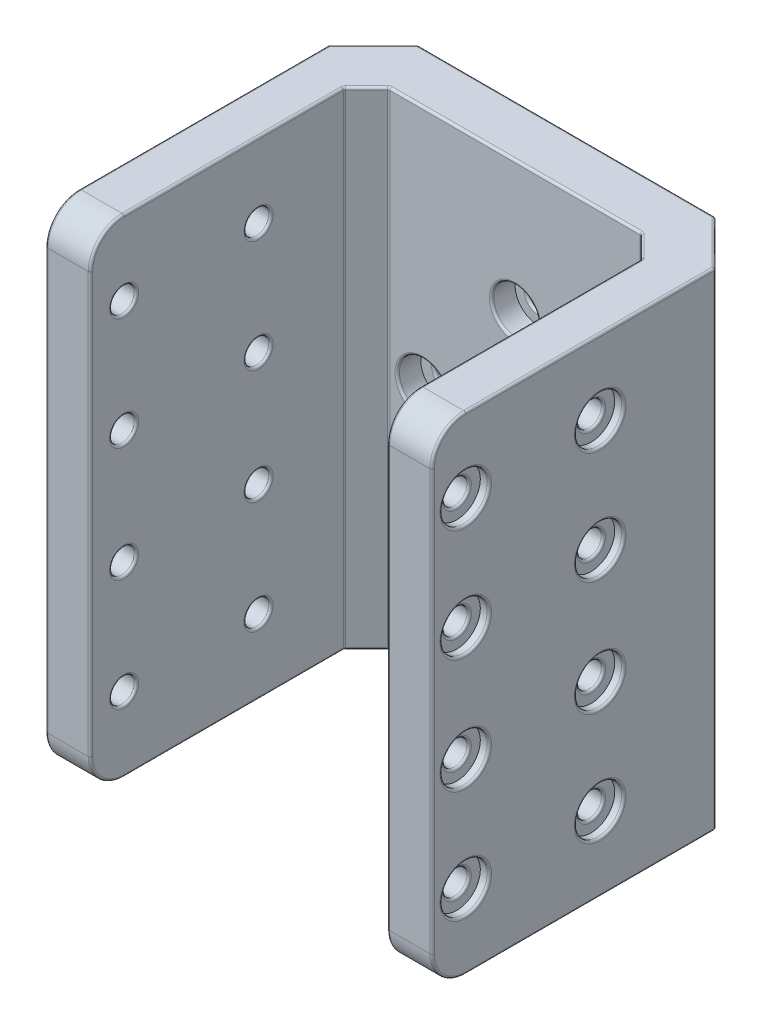
from build123d import *

# Parameters (mm, degrees)
SKETCH_2_R            = 0.75
CUT_EXTRUDE_1_DEPTH   = 18.557049866
SKETCH_1_2_W          = 26.5
SKETCH_1_2_H          = 43.5
SKETCH_1_2_R          = 12.5
SKETCH_1_2_W_2        = 4
EXTRUDE_1_DEPTH       = 5.2
EXTRUDE_START         = -3
EXTRUDE_2_OUTLINE_W   = 34.5
EXTRUDE_2_OUTLINE_H   = 43.5
EXTRUDE_2_OUTLINE_R   = 1.1
EXTRUDE_2_OUTLINE_R_2 = 4.5
EXTRUDE_2_DEPTH       = 3
SKETCH_1_5_W          = 4
SKETCH_1_5_H          = 43.5
EXTRUDE_3_DEPTH       = 26.25
SKETCH_5_R            = 2.1
SKETCH_5_R_2          = 2.268390803
CUT_EXTRUDE_4_DEPTH   = 0.5
SKETCH_6_R            = 1.1
CUT_EXTRUDE_5_DEPTH   = 50.049719673
SKETCH_7_R            = 2.1
CUT_EXTRUDE_6_DEPTH   = 0.8
CUT_EXTRUDE_START     = -34.5
SKETCH_7_2_R          = 2.1
CUT_EXTRUDE_7_DEPTH   = 0.8
SKETCH_8_R            = 33.777700114
CUT_EXTRUDE_8_DEPTH   = 41.326015176
SKETCH_9_W            = 26.5
SKETCH_9_H            = 43.5
SKETCH_9_R            = 2.268390803
SKETCH_9_R_2          = 4.5
SKETCH_9_R_3          = 2.1
EXTRUDE_4_DEPTH       = 1.6
CHAMFER_1_SIZE        = 2
CHAMFER_2_SIZE        = 4
FILLET_1_R            = 3
FILLET_2_R            = 0.2


# Read off the part's stored shape, not the designer's step: 보스-돌출2
with BuildPart() as part:
    # Sketch 1 → Повернуть1 (revolve)
    with BuildSketch(Plane(origin=(0, 0, 0), x_dir=(0, 0, -1), z_dir=(1, 0, 0)), mode=Mode.PRIVATE) as revolve_1_sk:
        Polygon((0, 3.75), (0, 12), (2, 12), (2, 4.5), (4.5, 4.5), (4.5, 3), (1.5, 3), (1.5, 1.4), (0.8, 1.4), (0.8, 3), (-0.5, 3), (-0.5, 3.75), align=None)
    revolve(revolve_1_sk.sketch.rotate(Axis((0, 0, 50), (0, 0, -1)), 90), axis=Axis((0, 0, 50), (0, 0, -1)))

    # Эскиз2 → Вырез-Вытянуть1 (cut, through all)
    with BuildSketch(Plane.XY):
        with Locations((8.25, 0)):
            Circle(SKETCH_2_R)
        with Locations((7.752464121, -2.821666182)):
            Circle(SKETCH_2_R)
        with Locations((7.752464121, 2.821666182)):
            Circle(SKETCH_2_R)
        with Locations((-8.25, 0)):
            Circle(SKETCH_2_R)
        with Locations((-7.752464121, -2.821666182)):
            Circle(SKETCH_2_R)
        with Locations((-7.752464121, 2.821666182)):
            Circle(SKETCH_2_R)
        with Locations((0, 7)):
            Circle(SKETCH_2_R)
        with Locations((0, 10)):
            Circle(SKETCH_2_R)
        with Locations((2.394141003, 6.577848346)):
            Circle(SKETCH_2_R)
        with Locations((3.420201433, 9.396926208)):
            Circle(SKETCH_2_R)
        with Locations((-2.394141003, 6.577848346)):
            Circle(SKETCH_2_R)
        with Locations((-3.420201433, 9.396926208)):
            Circle(SKETCH_2_R)
        with Locations((0, -7)):
            Circle(SKETCH_2_R)
        with Locations((0, -10)):
            Circle(SKETCH_2_R)
        with Locations((3.420201433, -9.396926208)):
            Circle(SKETCH_2_R)
        with Locations((2.394141003, -6.577848346)):
            Circle(SKETCH_2_R)
        with Locations((-2.394141003, -6.577848346)):
            Circle(SKETCH_2_R)
        with Locations((-3.420201433, -9.396926208)):
            Circle(SKETCH_2_R)
    extrude(amount=-CUT_EXTRUDE_1_DEPTH, mode=Mode.SUBTRACT)


with BuildPart() as body_2:
    # Sketch 1 2 → 보스-돌출1 (new body)
    # profile 1 of 3: a face of its own
    with BuildSketch(Plane(origin=(0, 0, -2), x_dir=(-1, 0, 0), z_dir=(0, 0, -1))):
        Rectangle(SKETCH_1_2_W, SKETCH_1_2_H)
        Circle(SKETCH_1_2_R, mode=Mode.SUBTRACT)
    # profile 2 of 3: a face of its own
    with BuildSketch(Plane(origin=(0, 0, -2), x_dir=(-1, 0, 0), z_dir=(0, 0, -1))):
        with Locations((15.25, 0)):
            Rectangle(SKETCH_1_2_W_2, SKETCH_1_2_H)
    # profile 3 of 3: a face of its own
    with BuildSketch(Plane(origin=(0, 0, -2), x_dir=(-1, 0, 0), z_dir=(0, 0, -1))):
        with Locations((-15.25, 0)):
            Rectangle(SKETCH_1_2_W_2, SKETCH_1_2_H)
    extrude(amount=EXTRUDE_1_DEPTH)

    # 보스-돌출2 outline → 보스-돌출2 (add)
    with BuildSketch(Plane(origin=(0, 0, -2), x_dir=(-1, 0, 0), z_dir=(0, 0, -1)).offset(EXTRUDE_START)):
        Rectangle(EXTRUDE_2_OUTLINE_W, EXTRUDE_2_OUTLINE_H)
        with Locations((0, -10)):
            Circle(EXTRUDE_2_OUTLINE_R, mode=Mode.SUBTRACT)
        with Locations((-8.25, 0)):
            Circle(EXTRUDE_2_OUTLINE_R, mode=Mode.SUBTRACT)
        Circle(EXTRUDE_2_OUTLINE_R_2, mode=Mode.SUBTRACT)
        with Locations((8.25, 0)):
            Circle(EXTRUDE_2_OUTLINE_R, mode=Mode.SUBTRACT)
        with Locations((0, 10)):
            Circle(EXTRUDE_2_OUTLINE_R, mode=Mode.SUBTRACT)
    extrude(amount=EXTRUDE_2_DEPTH)

    # 스케치1<5> → 보스-돌출3 (add)
    with BuildSketch(Plane(origin=(0, 0, -2), x_dir=(-1, 0, 0), z_dir=(0, 0, -1)).offset(EXTRUDE_START)):
        with Locations((15.25, 0)):
            Rectangle(SKETCH_1_5_W, SKETCH_1_5_H)
        with Locations((-15.25, 0)):
            Rectangle(SKETCH_1_5_W, SKETCH_1_5_H)
    extrude(amount=-EXTRUDE_3_DEPTH)

    # 스케치5 → 컷-돌출4 (cut)
    with BuildSketch(Plane.XY.offset(1)):
        with Locations((0, 10)):
            Circle(SKETCH_5_R)
        with Locations((-8.25, 0)):
            Circle(SKETCH_5_R_2)
        with Locations((0, -10)):
            Circle(SKETCH_5_R_2)
        with Locations((8.25, 0)):
            Circle(SKETCH_5_R_2)
    extrude(amount=-CUT_EXTRUDE_4_DEPTH, mode=Mode.SUBTRACT)

    # 스케치6 → 컷-돌출5 (cut, through all)
    with BuildSketch(Plane.ZY.offset(17.25)):
        with Locations(Location((12.25, 15.1, 0), (0, 0, 270))):
            Circle(SKETCH_6_R)
        with Locations(Location((24.25, 15.1, 0), (0, 0, 270))):
            Circle(SKETCH_6_R)
        with Locations(Location((12.25, 5.1, 0), (0, 0, 270))):
            Circle(SKETCH_6_R)
        with Locations(Location((24.25, -5.1, 0), (0, 0, 270))):
            Circle(SKETCH_6_R)
        with Locations(Location((12.25, -5.1, 0), (0, 0, 270))):
            Circle(SKETCH_6_R)
        with Locations(Location((12.25, -15.1, 0), (0, 0, 270))):
            Circle(SKETCH_6_R)
        with Locations(Location((24.25, -15.1, 0), (0, 0, 270))):
            Circle(SKETCH_6_R)
        with Locations(Location((24.25, 5.1, 0), (0, 0, 270))):
            Circle(SKETCH_6_R)
    extrude(amount=-CUT_EXTRUDE_5_DEPTH, mode=Mode.SUBTRACT)

    # 스케치7 → 컷-돌출6 (cut)
    with BuildSketch(Plane.ZY.offset(17.25)):
        with Locations(Location((12.25, 15.1, 0), (0, 0, 270))):
            Circle(SKETCH_7_R)
        with Locations(Location((12.25, 5.1, 0), (0, 0, 270))):
            Circle(SKETCH_7_R)
        with Locations(Location((12.25, -5.1, 0), (0, 0, 270))):
            Circle(SKETCH_7_R)
        with Locations(Location((12.25, -15.1, 0), (0, 0, 270))):
            Circle(SKETCH_7_R)
        with Locations(Location((24.25, -5.1, 0), (0, 0, 270))):
            Circle(SKETCH_7_R)
        with Locations(Location((24.25, 5.1, 0), (0, 0, 270))):
            Circle(SKETCH_7_R)
        with Locations(Location((24.25, 15.1, 0), (0, 0, 270))):
            Circle(SKETCH_7_R)
        with Locations(Location((24.25, -15.1, 0), (0, 0, 270))):
            Circle(SKETCH_7_R)
    extrude(amount=-CUT_EXTRUDE_6_DEPTH, mode=Mode.SUBTRACT)

    # 스케치7<2> → 컷-돌출7 (cut)
    with BuildSketch(Plane.ZY.offset(17.25).offset(CUT_EXTRUDE_START)):
        with Locations(Location((12.25, 15.1, 0), (0, 0, 270))):
            Circle(SKETCH_7_2_R)
        with Locations(Location((12.25, 5.1, 0), (0, 0, 270))):
            Circle(SKETCH_7_2_R)
        with Locations(Location((12.25, -5.1, 0), (0, 0, 270))):
            Circle(SKETCH_7_2_R)
        with Locations(Location((12.25, -15.1, 0), (0, 0, 270))):
            Circle(SKETCH_7_2_R)
        with Locations(Location((24.25, -5.1, 0), (0, 0, 270))):
            Circle(SKETCH_7_2_R)
        with Locations(Location((24.25, 5.1, 0), (0, 0, 270))):
            Circle(SKETCH_7_2_R)
        with Locations(Location((24.25, 15.1, 0), (0, 0, 270))):
            Circle(SKETCH_7_2_R)
        with Locations(Location((24.25, -15.1, 0), (0, 0, 270))):
            Circle(SKETCH_7_2_R)
    extrude(amount=CUT_EXTRUDE_7_DEPTH, mode=Mode.SUBTRACT)

    # 스케치8 → 컷-돌출8 (cut, through all)
    with BuildSketch(Plane(origin=(0, 0, -2), x_dir=(-1, 0, 0), z_dir=(0, 0, -1))):
        Circle(SKETCH_8_R)
    extrude(amount=CUT_EXTRUDE_8_DEPTH, mode=Mode.SUBTRACT)

    # 스케치9 → 보스-돌출4 (add)
    with BuildSketch(Plane.XY.offset(1)):
        Rectangle(SKETCH_9_W, SKETCH_9_H)
        with Locations((-8.25, 0)):
            Circle(SKETCH_9_R, mode=Mode.SUBTRACT)
        with Locations((0, -10)):
            Circle(SKETCH_9_R, mode=Mode.SUBTRACT)
        with Locations((8.25, 0)):
            Circle(SKETCH_9_R, mode=Mode.SUBTRACT)
        with Locations(Location((0, 0, 0), (0, 0, 180))):
            Circle(SKETCH_9_R_2, mode=Mode.SUBTRACT)
        with Locations((0, 10)):
            Circle(SKETCH_9_R_3, mode=Mode.SUBTRACT)
    extrude(amount=EXTRUDE_4_DEPTH)

    # 모따기1
    chamfer_1_edges = [body_2.edges().sort_by_distance(p)[0] for p in [
        (13.25, 0, 2.6),
        (-13.25, 0, 2.6),
    ]]
    chamfer(chamfer_1_edges, length=CHAMFER_1_SIZE)

    # 모따기2
    chamfer_2_edges = [body_2.edges().sort_by_distance(p)[0] for p in [
        (17.25, 0, -2),
        (-17.25, 0, -2),
    ]]
    chamfer(chamfer_2_edges, length=CHAMFER_2_SIZE)

    # 필렛1
    fillet_1_edges = [body_2.edges().sort_by_distance(p)[0] for p in [
        (-15.25, -21.75, 27.25),
        (-15.25, 21.75, 27.25),
        (15.25, 21.75, 27.25),
        (15.25, -21.75, 27.25),
    ]]
    fillet(fillet_1_edges, radius=FILLET_1_R)

    # 필렛2
    fillet_2_edges = [body_2.edges().sort_by_distance(p)[0] for p in [
        (-13.25, 16.2, 24.25),
        (13.25, 16.2, 24.25),
        (-13.25, 6.2, 12.25),
        (13.25, 6.2, 12.25),
        (-13.25, -4, 24.25),
        (13.25, -4, 24.25),
        (-13.25, -4, 12.25),
        (13.25, -4, 12.25),
        (-13.25, -14, 12.25),
        (13.25, -14, 12.25),
        (-13.25, -14, 24.25),
        (13.25, -14, 24.25),
        (-13.25, 6.2, 24.25),
        (13.25, 6.2, 24.25),
        (-13.25, 16.2, 12.25),
        (13.25, 16.2, 12.25),
        (-17.25, -3, 24.25),
        (-16.45, -4, 24.25),
        (-17.25, -13, 12.25),
        (-16.45, -14, 12.25),
        (-17.25, -3, 12.25),
        (-16.45, -4, 12.25),
        (-17.25, 7.2, 12.25),
        (-16.45, 6.2, 12.25),
        (-17.25, 7.2, 24.25),
        (-16.45, 6.2, 24.25),
        (-17.25, 17.2, 24.25),
        (-16.45, 16.2, 24.25),
        (-17.25, -13, 24.25),
        (-16.45, -14, 24.25),
        (-17.25, 17.2, 12.25),
        (-16.45, 16.2, 12.25),
        (16.45, -4, 24.25),
        (17.25, -3, 24.25),
        (16.45, -14, 12.25),
        (17.25, -13, 12.25),
        (4.5, 0, -2),
        (16.45, -4, 12.25),
        (17.25, -3, 12.25),
        (16.45, 6.2, 12.25),
        (17.25, 7.2, 12.25),
        (16.45, 6.2, 24.25),
        (17.25, 7.2, 24.25),
        (16.45, 16.2, 24.25),
        (17.25, 17.2, 24.25),
        (16.45, -14, 24.25),
        (17.25, -13, 24.25),
        (16.45, 16.2, 12.25),
        (17.25, 17.2, 12.25),
        (1.1, 10, -2),
        (9.35, 0, -2),
        (1.1, -10, -2),
        (-7.15, 0, -2),
        (-10.518390803, 0, 2.6),
        (-2.268390803, -10, 2.6),
        (5.981609197, 0, 2.6),
        (4.5, 0, 2.6),
        (-2.1, 10, 2.6),
        (0, -21.75, 2.6),
        (0, 21.75, 2.6),
        (-11.25, 0, 2.6),
        (11.25, 0, 2.6),
        (13.25, 0, 4.6),
        (-13.25, 0, 4.6),
        (12.25, 21.75, 3.6),
        (12.25, -21.75, 3.6),
        (-12.25, -21.75, 3.6),
        (-12.25, 21.75, 3.6),
        (0, 21.75, -2),
        (0, -21.75, -2),
        (-13.25, 0, -2),
        (13.25, 0, -2),
        (-17.25, -21.75, 13.125),
        (17.25, -21.75, 13.125),
        (-15.25, -21.75, 0),
        (15.25, -21.75, 0),
        (17.25, 21.75, 13.125),
        (17.25, 0, 2),
        (-17.25, 21.75, 13.125),
        (-15.25, 21.75, 0),
        (15.25, 21.75, 0),
        (-17.25, 0, 2),
        (17.25, 0, 27.25),
        (13.25, 0, 27.25),
        (17.25, 20.871320344, 26.371320344),
        (17.25, -20.871320344, 26.371320344),
        (13.25, -21.75, 14.425),
        (-13.25, -21.75, 14.425),
        (13.25, 21.75, 14.425),
        (13.25, 20.871320344, 26.371320344),
        (13.25, -20.871320344, 26.371320344),
        (-13.25, 21.75, 14.425),
        (-17.25, 0, 27.25),
        (-13.25, 0, 27.25),
        (-17.25, -20.871320344, 26.371320344),
        (-17.25, 20.871320344, 26.371320344),
        (-13.25, -20.871320344, 26.371320344),
        (-13.25, 20.871320344, 26.371320344),
        (1.1, 10, 0.5),
        (-7.15, 0, 0.5),
        (1.1, -10, 0.5),
        (9.35, 0, 0.5),
    ]]
    fillet(fillet_2_edges, radius=FILLET_2_R)


solid = Compound([part.part, body_2.part])
